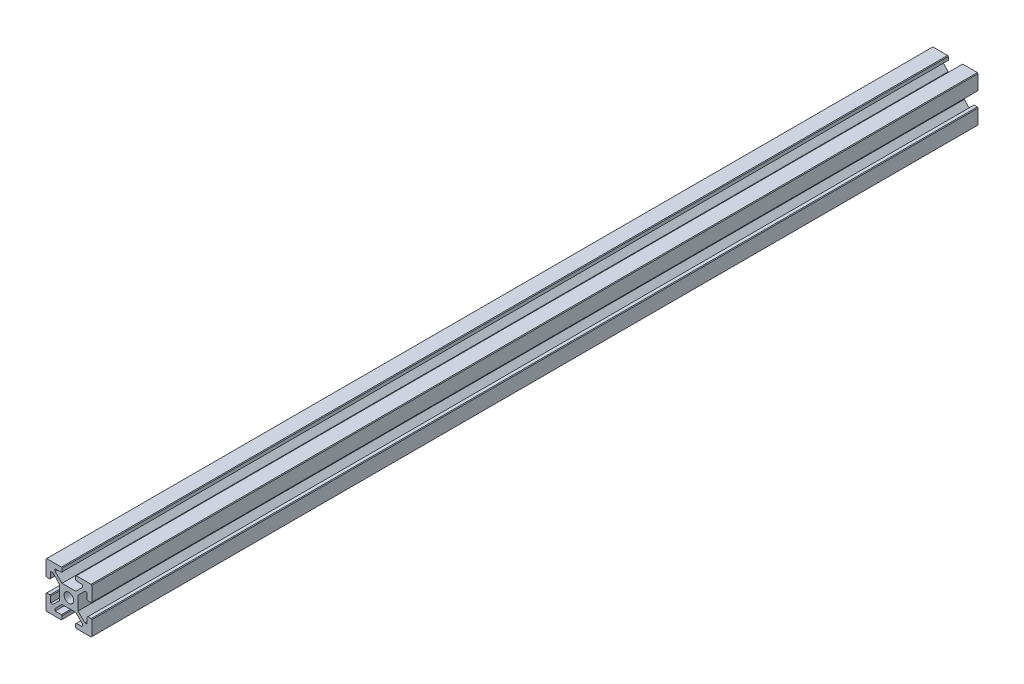
from build123d import *

# Parameters (mm, degrees)
SKETCH1_R           = 2.1
BOSS_EXTRUDE1_DEPTH = 387.35
CHAMFER1_SIZE       = 0.2828


with BuildPart() as part:
    # Sketch1 → Boss-Extrude1 (new body)
    with BuildSketch(Plane.XY):
        Polygon((-3, 8), (-3, 10), (-10, 10), (-10, 3), (-8, 3), (-8, 6), (-7, 6), (-4, 3), (-4, -3), (-7, -6), (-8, -6), (-8, -3), (-10, -3), (-10, -10), (-3, -10), (-3, -8), (-6, -8), (-6, -7), (-3, -4), (3, -4), (6, -7), (6, -8), (3, -8), (3, -10), (10, -10), (10, -3), (8, -3), (8, -6), (7, -6), (4, -3), (4, 3), (7, 6), (8, 6), (8, 3), (10, 3), (10, 10), (3, 10), (3, 8), (6, 8), (6, 7), (3, 4), (-3, 4), (-6, 7), (-6, 8), align=None)
        Circle(SKETCH1_R, mode=Mode.SUBTRACT)
    extrude(amount=BOSS_EXTRUDE1_DEPTH)

    # Chamfer1
    chamfer1_edges = [part.edges().sort_by_distance(p)[0] for p in [
        (-8, 3, 193.675),
        (-3, 8, 193.675),
        (-3, 10, 193.675),
        (-10, 3, 193.675),
        (-10, 10, 193.675),
        (-8, -3, 193.675),
        (-10, -3, 193.675),
        (-10, -10, 193.675),
        (-3, -10, 193.675),
        (-3, -8, 193.675),
        (3, -8, 193.675),
        (3, -10, 193.675),
        (8, -3, 193.675),
        (10, -10, 193.675),
        (10, -3, 193.675),
        (8, 3, 193.675),
        (10, 3, 193.675),
        (10, 10, 193.675),
        (3, 8, 193.675),
        (3, 10, 193.675),
    ]]
    chamfer(chamfer1_edges, length=CHAMFER1_SIZE)


solid = part.part
